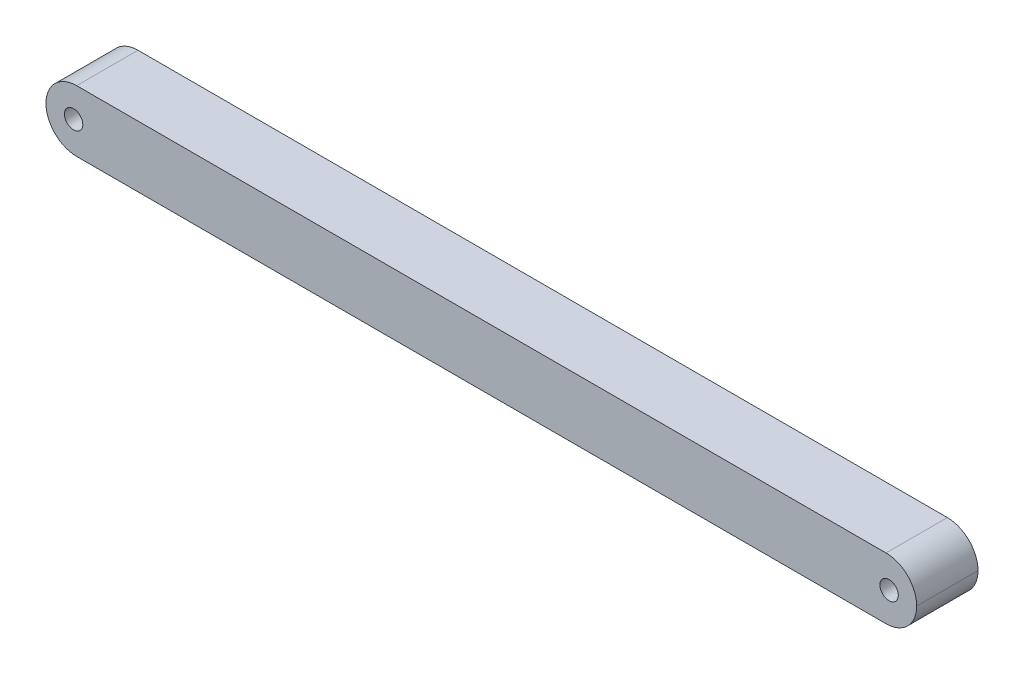
from build123d import *

# Parameters (mm, degrees)
BOSS_EXTRUDE1_DEPTH = 10
FILLET2_R           = 5
FILLET3_R           = 5
FILLET4_R           = 5
FILLET5_R           = 5


with BuildPart() as part:
    # Sketch1 → Boss-Extrude1 (new body)
    with BuildSketch(Plane.XY):
        with BuildLine():
            Line((0, 10), (0, 5))
            Line((0, 5), (3, 5))
            ThreePointArc((3, 5), (4.5, 6.5), (6, 5))
            Line((6, 5), (136, 5))
            ThreePointArc((136, 5), (137.5, 6.5), (139, 5))
            Line((139, 5), (142, 5))
            Line((142, 5), (142, 10))
            Line((142, 10), (0, 10))
        make_face()
        with BuildLine():
            Line((3, 5), (0, 5))
            Line((0, 5), (0, 0))
            Line((0, 0), (142, 0))
            Line((142, 0), (142, 5))
            Line((142, 5), (139, 5))
            ThreePointArc((139, 5), (137.5, 3.5), (136, 5))
            Line((136, 5), (6, 5))
            ThreePointArc((6, 5), (4.5, 3.5), (3, 5))
        make_face()
    extrude(amount=BOSS_EXTRUDE1_DEPTH)

    # Fillet2
    fillet2_edges = [part.edges().sort_by_distance(p)[0] for p in [
        (0, 10, 5),
    ]]
    fillet(fillet2_edges, radius=FILLET2_R)

    # Fillet3
    fillet3_edges = [part.edges().sort_by_distance(p)[0] for p in [
        (0, 0, 5),
    ]]
    fillet(fillet3_edges, radius=FILLET3_R - 0.0001)  # a hair under: the kernel refuses the full size

    # Fillet4
    fillet4_edges = [part.edges().sort_by_distance(p)[0] for p in [
        (142, 10, 5),
    ]]
    fillet(fillet4_edges, radius=FILLET4_R)

    # Fillet5
    fillet5_edges = [part.edges().sort_by_distance(p)[0] for p in [
        (142, 0, 5),
    ]]
    fillet(fillet5_edges, radius=FILLET5_R - 0.0001)  # a hair under: the kernel refuses the full size


solid = part.part
